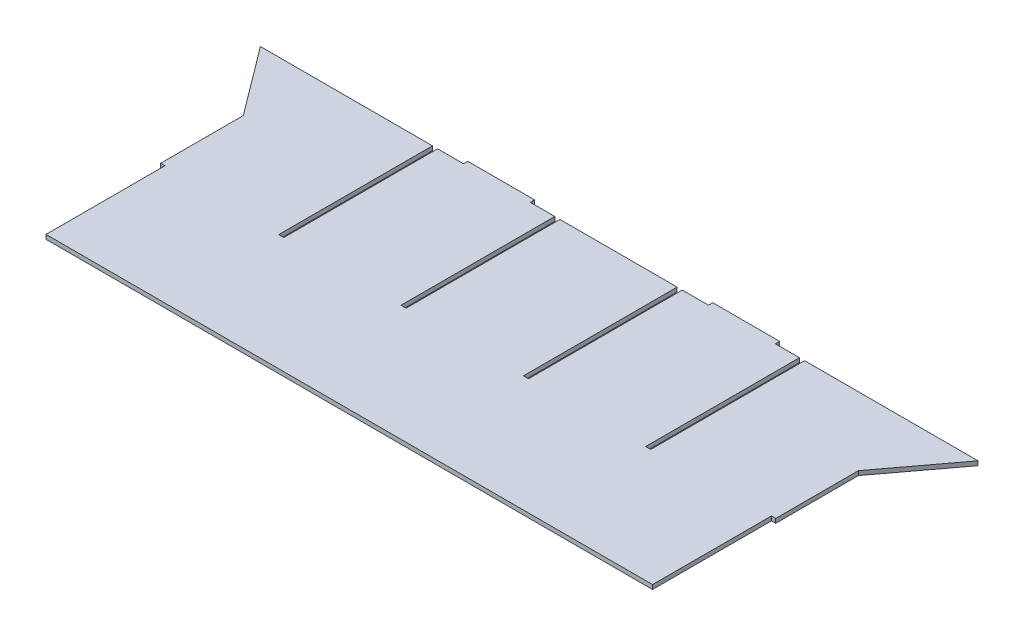
from build123d import *

# Parameters (mm, degrees)
SKETCH1_W           = 457.2020066
SKETCH1_H           = 3.175
BOSS_EXTRUDE1_DEPTH = 200.6419914
SKETCH2_W           = 3.81
SKETCH2_H           = 114.3
CUT_EXTRUDE1_DEPTH  = 305.180387349
LPATTERN1_COUNT     = 4
LPATTERN1_PITCH     = 90.932
BOSS_EXTRUDE3_DEPTH = 3.175
SKETCH5_W           = 3.175
SKETCH5_H           = 88.392
CUT_EXTRUDE2_DEPTH  = 3.175
SKETCH3_W           = 49.658811606
SKETCH3_H           = 3.175
BOSS_EXTRUDE4_DEPTH = 3.175


with BuildPart() as part:
    # Sketch1 → Boss-Extrude1 (new body)
    with BuildSketch(Plane.XY):
        Rectangle(SKETCH1_W, SKETCH1_H)
    extrude(amount=BOSS_EXTRUDE1_DEPTH)

    # Sketch2 → Cut-Extrude1 (cut, through all)
    with BuildSketch(Plane(origin=(0, 1.5875, 0), x_dir=(1, 0, 0), z_dir=(0, 1, 0))):
        with Locations((135.8910033, -57.15)):
            Rectangle(SKETCH2_W, SKETCH2_H)
    cut_extrude1 = extrude(amount=-CUT_EXTRUDE1_DEPTH, mode=Mode.SUBTRACT)

    # LPattern1: Cut-Extrude1 ×4
    with Locations(*[(-i * LPATTERN1_PITCH, 0, 0) for i in range(1, LPATTERN1_COUNT)]):
        add(cut_extrude1, mode=Mode.SUBTRACT)

    # Sketch4 → Boss-Extrude3 (add)
    with BuildSketch(Plane.XZ.offset(1.5875)):
        Polygon((-228.6010033, 0), (-266.7010033, 0), (-228.6010033, 50.8), align=None)
    boss_extrude3 = extrude(amount=-BOSS_EXTRUDE3_DEPTH)

    # Mirror1: Boss-Extrude3 across plane
    add(boss_extrude3.mirror(Plane(origin=(0, 0, 0), x_dir=(0, 0, 1), z_dir=(1, 0, 0))))

    # Sketch5 → Cut-Extrude2 (cut)
    with BuildSketch(Plane.XZ.offset(1.5875)):
        with Locations((-227.0135033, 156.4459914)):
            Rectangle(SKETCH5_W, SKETCH5_H)
    cut_extrude2 = extrude(amount=-CUT_EXTRUDE2_DEPTH, mode=Mode.SUBTRACT)

    # Mirror2: Cut-Extrude2 across plane
    add(cut_extrude2.mirror(Plane(origin=(0, 0, 0), x_dir=(0, 0, 1), z_dir=(1, 0, 0))), mode=Mode.SUBTRACT)

    # Sketch3 → Boss-Extrude4 (add)
    with BuildSketch(Plane(origin=(0, 0, 0), x_dir=(-1, 0, 0), z_dir=(0, 0, -1))):
        with Locations((-91.136597497, 0)):
            Rectangle(SKETCH3_W, SKETCH3_H)
        with Locations((90.903590841, 0)):
            Rectangle(SKETCH3_W, SKETCH3_H)
    extrude(amount=BOSS_EXTRUDE4_DEPTH)


solid = part.part
